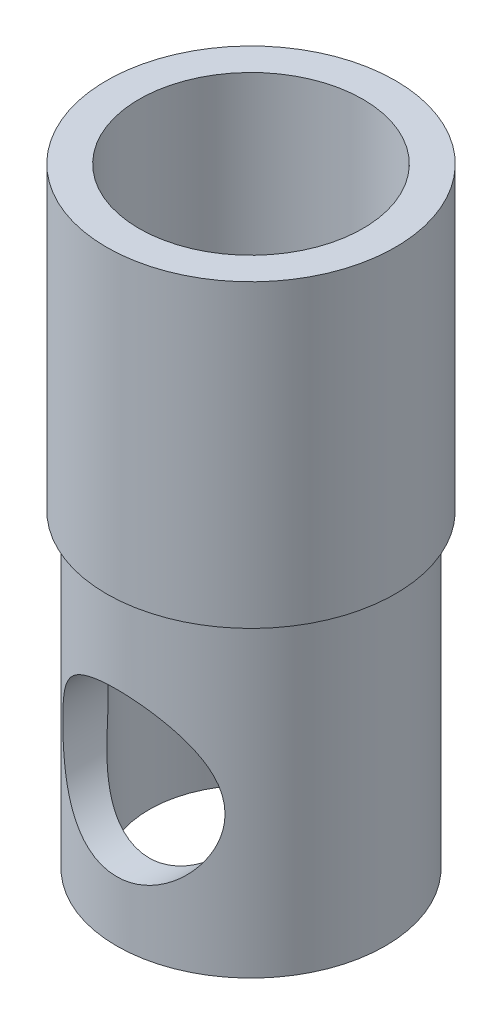
from build123d import *

# Parameters (mm, degrees)
BOSS_EXTRUDE1_DEPTH      = 1
BOSS_EXTRUDE1_DEPTH_BACK = 18.1
SKETCH1_R                = 8.28
SKETCH1_R_2              = 6.28
SKETCH2_R                = 8.9
SKETCH2_R_2              = 6.9
BOSS_EXTRUDE2_DEPTH      = 18.5
SKETCH3_R                = 5
CUT_EXTRUDE1_DEPTH       = 24.209265391


with BuildPart() as part:
    # Sketch1 → Boss-Extrude1 (new, two sides: drawn at the far end of the back side and taken through both)
    with BuildSketch(Plane(origin=(0, 0, 0), x_dir=(1, 0, 0), z_dir=(0, 1, 0)).offset(-BOSS_EXTRUDE1_DEPTH_BACK)):
        Circle(SKETCH1_R)
        Circle(SKETCH1_R_2, mode=Mode.SUBTRACT)
    extrude(amount=BOSS_EXTRUDE1_DEPTH + BOSS_EXTRUDE1_DEPTH_BACK)

    # Sketch2 → Boss-Extrude2 (add)
    with BuildSketch(Plane(origin=(0, 1, 0), x_dir=(1, 0, 0), z_dir=(0, 1, 0))):
        Circle(SKETCH2_R)
        Circle(SKETCH2_R_2, mode=Mode.SUBTRACT)
    extrude(amount=BOSS_EXTRUDE2_DEPTH)

    # Sketch3 → Cut-Extrude1 (cut, through all)
    with BuildSketch(Plane.XY):
        with Locations((0, -9.4)):
            Circle(SKETCH3_R)
    extrude(amount=CUT_EXTRUDE1_DEPTH, mode=Mode.SUBTRACT)


solid = part.part
